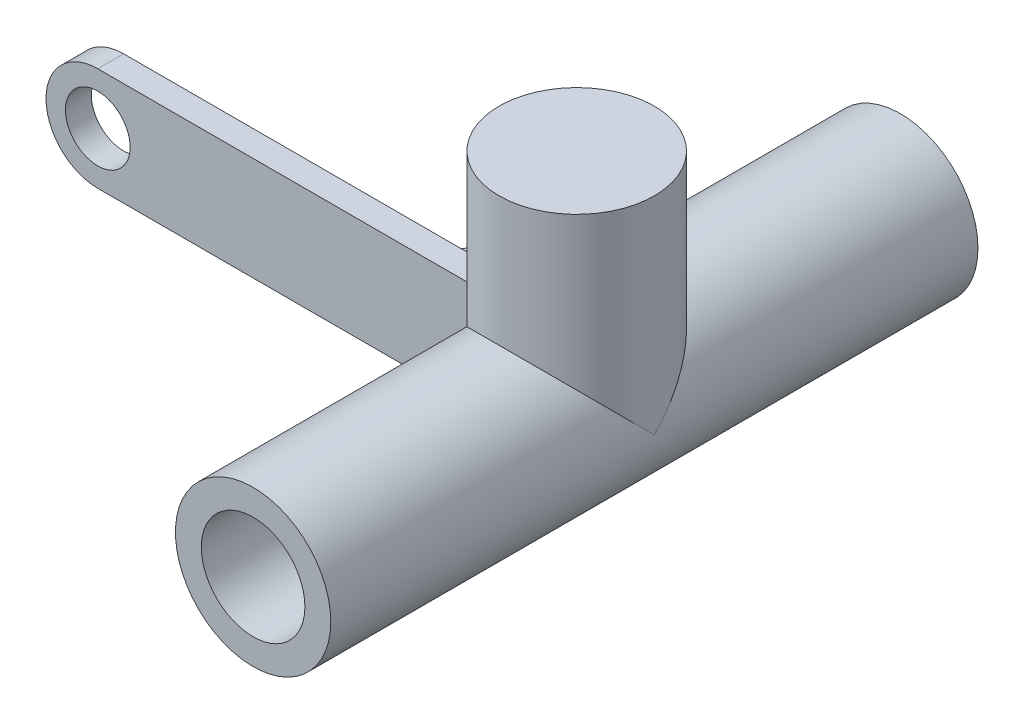
from build123d import *

# Parameters (mm, degrees)
SKETCH1_R               = 15
SKETCH1_R_2             = 10
BOSS_EXTRUDE1_DEPTH     = 125
SKETCH2_R               = 15
BOSS_EXTRUDE2_DEPTH     = 40
SKETCH11_W              = 5
SKETCH11_H              = 20
BOSS_EXTRUDE6_DEPTH     = 100
FILLET1_R               = 10
SKETCH12_W              = 28.03455484
SKETCH12_H              = 2
BOSS_EXTRUDE7_DEPTH     = 30
CUT_EXTRUDE1_DEPTH      = 23
CUT_EXTRUDE1_DEPTH_BACK = 5
SKETCH16_R              = 6.25
CUT_EXTRUDE2_DEPTH      = 7


with BuildPart() as part:
    # Sketch1 → Boss-Extrude1 (new body)
    with BuildSketch(Plane.XY):
        Circle(SKETCH1_R)
        Circle(SKETCH1_R_2, mode=Mode.SUBTRACT)
    extrude(amount=BOSS_EXTRUDE1_DEPTH)

    # Sketch2 → Boss-Extrude2 (add)
    with BuildSketch(Plane(origin=(0, 0, 0), x_dir=(1, 0, 0), z_dir=(0, 1, 0))):
        with Locations((0, -62.5)):
            Circle(SKETCH2_R)
    extrude(amount=BOSS_EXTRUDE2_DEPTH)

    # Sketch11 → Boss-Extrude6 (add)
    with BuildSketch(Plane(origin=(0, 0, 0), x_dir=(0, 0, -1), z_dir=(1, 0, 0))):
        with Locations((-62.5, 0)):
            Rectangle(SKETCH11_W, SKETCH11_H)
    extrude(amount=-BOSS_EXTRUDE6_DEPTH)

    # Fillet1
    fillet1_edges = [part.edges().sort_by_distance(p)[0] for p in [
        (-100, -10, 62.5),
        (-100, 10, 62.5),
    ]]
    fillet(fillet1_edges, radius=FILLET1_R - 0.0001)  # a hair under: the kernel refuses the full size

    # Sketch12 → Boss-Extrude7 (add)
    with BuildSketch(Plane(origin=(0, 0, 60), x_dir=(-1, 0, 0), z_dir=(0, 0, -1))):
        with Locations((28.01727742, 0)):
            Rectangle(SKETCH12_W, SKETCH12_H)
    extrude(amount=BOSS_EXTRUDE7_DEPTH)

    # Sketch13 → Cut-Extrude1 (cut, two sides: drawn at the far end of the back side and taken through both)
    with BuildSketch(Plane(origin=(0, 0, 0), x_dir=(1, 0, 0), z_dir=(0, 1, 0)).offset(-CUT_EXTRUDE1_DEPTH_BACK)):
        Polygon((-14.966629547, -30), (-42.03455484, -60), (-42.03455484, -30), align=None)
    extrude(amount=CUT_EXTRUDE1_DEPTH + CUT_EXTRUDE1_DEPTH_BACK, mode=Mode.SUBTRACT)

    # Sketch16 → Cut-Extrude2 (cut)
    with BuildSketch(Plane(origin=(0, 0, 60), x_dir=(-1, 0, 0), z_dir=(0, 0, -1))):
        with Locations((90, 0)):
            Circle(SKETCH16_R)
    extrude(amount=-CUT_EXTRUDE2_DEPTH, mode=Mode.SUBTRACT)


solid = part.part
